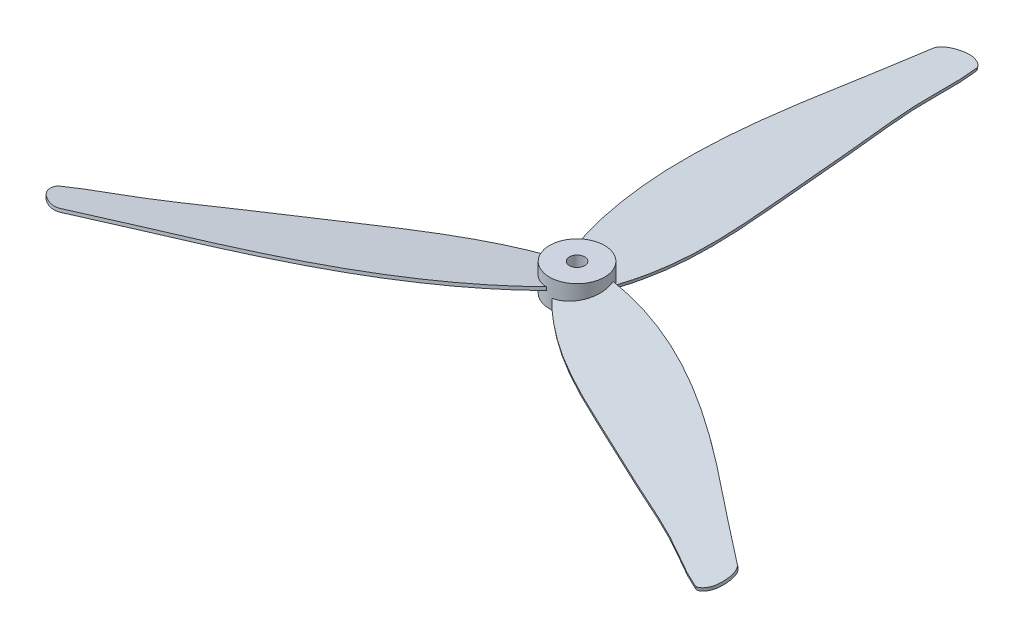
from build123d import *

# Parameters (mm, degrees)
SKETCH1_R           = 9
SKETCH1_R_2         = 2.5
BOSS_EXTRUDE1_DEPTH = 9
BOSS_EXTRUDE2_START = -4.5
BOSS_EXTRUDE2_DEPTH = 1
CIRPATTERN1_COUNT   = 3


with BuildPart() as part:
    # Sketch1 → Boss-Extrude1 (new body)
    with BuildSketch(Plane(origin=(0, 0, 0), x_dir=(1, 0, 0), z_dir=(0, 1, 0))):
        Circle(SKETCH1_R)
        Circle(SKETCH1_R_2, mode=Mode.SUBTRACT)
    extrude(amount=BOSS_EXTRUDE1_DEPTH)

    # Sketch2 → Boss-Extrude2 (add)
    with BuildSketch(Plane(origin=(0, 0, 0), x_dir=(0.5030779148512428, -0.07821723252011066, 0.8606942988807471), z_dir=(0.07821723252011625, -0.9876883405951378, -0.13547622075226848)).offset(BOSS_EXTRUDE2_START)):
        with BuildLine():
            ThreePointArc((7.057167207, 3.522296079), (6.485622082, -4.488528141), (-0.810263482, -7.845613536))
            add(Edge.make_bspline(
                [(-0.810263482, -7.845613536), (14.84556885, -26.528236143), (50.110026658, -46.96867352), (87.58233528, -60.277903004), (104.394373747, -67.496596406), (108.694675079, -65.622418883), (111.839467858, -62.293667025), (111.674369285, -59.14487647), (110.334821186, -58.189477886), (105.387973441, -54.647266008), (93.470266374, -48.531390342), (77.381003607, -36.65329381), (48.752102578, -17.489898423), (26.964124286, -1.279240997), (7.057167207, 3.522296079)],
                knots=[0, 0, 0, 0, 0.282933447, 0.46648255, 0.471857062, 0.495005992, 0.514382548, 0.523354602, 0.526650828, 0.533187201, 0.595375398, 0.682473253, 0.767935763, 1, 1, 1, 1], degree=3))
        make_face()
    boss_extrude2 = extrude(amount=BOSS_EXTRUDE2_DEPTH)

    # CirPattern1: Boss-Extrude2 ×3 about axis
    cirpattern1_axis = Axis((0, 9, 0), (0, 1, 0))
    for i in range(1, CIRPATTERN1_COUNT):
        add(boss_extrude2.rotate(cirpattern1_axis, i * 360 / CIRPATTERN1_COUNT))


solid = part.part
